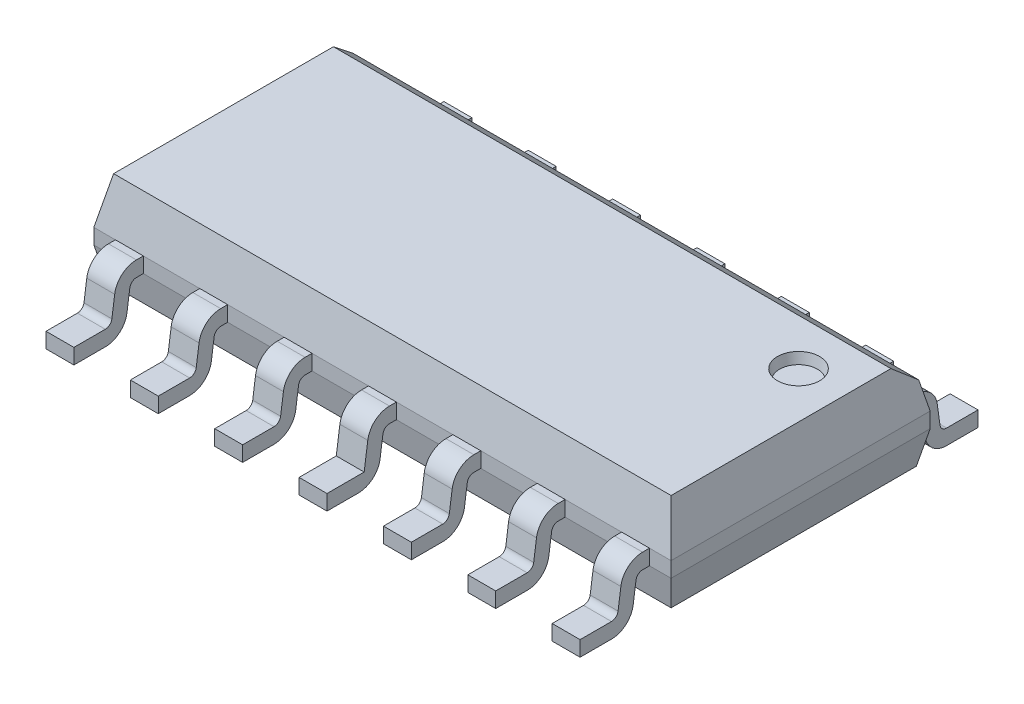
from build123d import *

# Parameters (mm, degrees)
SKETCH1_W                = 8.69
SKETCH1_H                = 3.9
EXTRUDE1_DEPTH           = 0.7
EXTRUDE1_TAPER           = 12
EXTRUDE1_OTHER_WAY_DEPTH = 0.23
SKETCH2_W                = 8.69
SKETCH2_H                = 3.9
EXTRUDE2_DEPTH           = 0.49
EXTRUDE2_TAPER           = 12
CHAMFER1_SIZE            = 0.29360287
CHAMFER1_SIZE_2          = 0.3
SKETCH3_R                = 0.317461986
CUT_EXTRUDE1_DEPTH       = 0.15
CUT_EXTRUDE1_DRAFT       = -12
EXTRUDE3_DEPTH           = 0.21
LPATTERN3_COUNT          = 4
LPATTERN3_PITCH          = 1.27
LPATTERN3_COL_COUNT      = 4
LPATTERN3_COL_PITCH      = 1.27
FILLET1_R                = 0.1
FILLET2_R                = 0.33


with BuildPart() as part:
    # Sketch1 → Extrude1 (new body)
    with BuildSketch(Plane(origin=(0, 0, 0), x_dir=(1, 0, 0), z_dir=(0, 1, 0))):
        Rectangle(SKETCH1_W, SKETCH1_H)
    extrude(amount=EXTRUDE1_DEPTH, taper=EXTRUDE1_TAPER)

    # Sketch1 → Extrude1 other way (add)
    with BuildSketch(Plane(origin=(0, 0, 0), x_dir=(1, 0, 0), z_dir=(0, 1, 0))):
        Rectangle(SKETCH1_W, SKETCH1_H)
    extrude(amount=-EXTRUDE1_OTHER_WAY_DEPTH)

    # Sketch2 → Extrude2 (add)
    with BuildSketch(Plane.XZ.offset(0.23)):
        Rectangle(SKETCH2_W, SKETCH2_H)
    extrude(amount=EXTRUDE2_DEPTH, taper=EXTRUDE2_TAPER)

    # Chamfer1
    # the kernel refuses this chamfer: 0.3, 0.29360287 mm, written as the material it takes off along each edge
    with BuildSketch(Plane(origin=(4.969914076, 0.7, -1.801210407), x_dir=(0, 0.025194664498195983, 0.9996825640576229), z_dir=(-1, 0, 0))) as chamfer1_piece_1:
        Polygon((CHAMFER1_SIZE * 0.999682563914, -CHAMFER1_SIZE * 0.0251946644946), (-CHAMFER1_SIZE_2 * 0.232489792804, -CHAMFER1_SIZE_2 * 0.972598836233), (0, 0), align=None)
    extrude(amount=9.939828151, mode=Mode.SUBTRACT)


with BuildPart() as cut_extrude1_tool:
    # Sketch3 → Cut-Extrude1 (with draft: the straight prism first)
    with BuildSketch(Plane(origin=(0, 0.7, 0), x_dir=(-1, 0, 0), z_dir=(0, 1, 0))):
        with Locations((-3.501533305, -0.811859934)):
            Circle(SKETCH3_R)
    extrude(amount=-CUT_EXTRUDE1_DEPTH)
    # Cut-Extrude1: the draft: its side faces are tilted about the plane it starts from
    cut_extrude1_sides = [cut_extrude1_tool.faces().sort_by_distance(p)[0] for p in [
        (3.818995291, 0.625, -0.811859934),
    ]]
    draft(cut_extrude1_sides, Plane(origin=(0, 0.7, 0), x_dir=(-1, 0, 0), z_dir=(0, 1, 0)), CUT_EXTRUDE1_DRAFT)


with BuildPart() as part_1:
    add(part.part)

    # Cut-Extrude1: cut by cut_extrude1_tool
    add(cut_extrude1_tool.part, mode=Mode.SUBTRACT)

    # Sketch4 → Extrude3 (add, symmetric)
    with BuildSketch(Plane(origin=(0, 0, 0), x_dir=(0, 0, -1), z_dir=(1, 0, 0))):
        Polygon((1.95, -0.23), (-1.95, -0.23), (-2.141337425, -0.23), (-2.235499784, -0.9), (-2.995, -0.9), (-2.995, -0.67), (-2.435435734, -0.67), (-2.341273375, 0), (-1.95, 0), (1.95, 0), (2.341273375, 0), (2.435435734, -0.67), (2.995, -0.67), (2.995, -0.9), (2.235499784, -0.9), (2.141337425, -0.23), align=None)
    extrude3 = extrude(amount=EXTRUDE3_DEPTH, both=True)

    # LPattern3: Extrude3 ×4
    with Locations(*[(i * LPATTERN3_PITCH, 0, 0) for i in range(1, LPATTERN3_COUNT)]):
        add(extrude3)

    # LPattern3 col: Extrude3 ×4
    with Locations(*[(-i * LPATTERN3_COL_PITCH, 0, 0) for i in range(1, LPATTERN3_COL_COUNT)]):
        add(extrude3)

    # Fillet1
    fillet1_edges = [part_1.edges().sort_by_distance(p)[0] for p in [
        (-1.27, -0.23, 2.141337425),
        (-1.27, -0.23, -2.141337425),
        (-1.27, -0.67, -2.435435734),
        (-1.27, -0.67, 2.435435734),
        (-2.54, -0.23, 2.141337425),
        (-2.54, -0.23, -2.141337425),
        (-2.54, -0.67, -2.435435734),
        (-2.54, -0.67, 2.435435734),
        (-3.81, -0.23, 2.141337425),
        (-3.81, -0.23, -2.141337425),
        (-3.81, -0.67, -2.435435734),
        (-3.81, -0.67, 2.435435734),
        (1.27, -0.23, 2.141337425),
        (1.27, -0.23, -2.141337425),
        (1.27, -0.67, -2.435435734),
        (1.27, -0.67, 2.435435734),
        (2.54, -0.23, 2.141337425),
        (2.54, -0.23, -2.141337425),
        (2.54, -0.67, -2.435435734),
        (2.54, -0.67, 2.435435734),
        (3.81, -0.23, 2.141337425),
        (3.81, -0.23, -2.141337425),
        (3.81, -0.67, -2.435435734),
        (3.81, -0.67, 2.435435734),
        (0, -0.23, 2.141337425),
        (0, -0.23, -2.141337425),
        (0, -0.67, -2.435435734),
    ]]
    fillet(fillet1_edges, radius=FILLET1_R)

    # Fillet2
    fillet2_edges = [part_1.edges().sort_by_distance(p)[0] for p in [
        (-1.27, 0, -2.341273375),
        (-1.27, -0.9, -2.235499784),
        (-1.27, 0, 2.341273375),
        (-1.27, -0.9, 2.235499784),
        (-2.54, 0, -2.341273375),
        (-2.54, -0.9, -2.235499784),
        (-2.54, 0, 2.341273375),
        (-2.54, -0.9, 2.235499784),
        (-3.81, 0, -2.341273375),
        (-3.81, -0.9, -2.235499784),
        (-3.81, 0, 2.341273375),
        (-3.81, -0.9, 2.235499784),
        (1.27, 0, -2.341273375),
        (1.27, -0.9, -2.235499784),
        (1.27, 0, 2.341273375),
        (1.27, -0.9, 2.235499784),
        (2.54, 0, -2.341273375),
        (2.54, -0.9, -2.235499784),
        (2.54, 0, 2.341273375),
        (2.54, -0.9, 2.235499784),
        (3.81, 0, -2.341273375),
        (3.81, -0.9, -2.235499784),
        (3.81, 0, 2.341273375),
        (3.81, -0.9, 2.235499784),
        (0, 0, -2.341273375),
        (0, -0.9, -2.235499784),
        (0, 0, 2.341273375),
        (0, -0.9, 2.235499784),
    ]]
    fillet(fillet2_edges, radius=FILLET2_R)


solid = part_1.part
